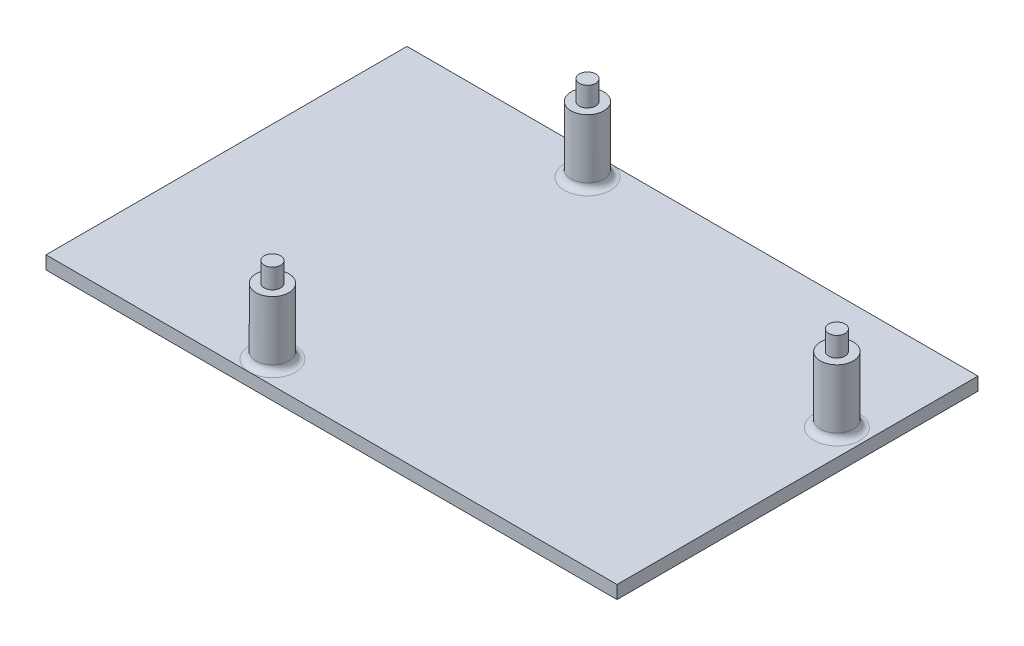
from build123d import *

# Parameters (mm, degrees)
SKETCH1_W           = 87
SKETCH1_H           = 55
BOSS_EXTRUDE1_DEPTH = 2
SKETCH2_R           = 2.5
BOSS_EXTRUDE2_DEPTH = 10
SKETCH3_R           = 1.25
BOSS_EXTRUDE3_DEPTH = 3
FILLET2_R           = 1


with BuildPart() as part:
    # Sketch1 → Boss-Extrude1 (new body)
    with BuildSketch(Plane(origin=(0, 0, 0), x_dir=(1, 0, 0), z_dir=(0, 1, 0))):
        with Locations((43.5, 27.5)):
            Rectangle(SKETCH1_W, SKETCH1_H)
    extrude(amount=BOSS_EXTRUDE1_DEPTH)

    # Sketch2 → Boss-Extrude2 (add)
    with BuildSketch(Plane(origin=(0, 2, 0), x_dir=(1, 0, 0), z_dir=(0, 1, 0))):
        with Locations(Location((31, 51.5, 0), (0, 0, 90))):
            Circle(SKETCH2_R)
        with Locations(Location((31, 3.5, 0), (0, 0, 90))):
            Circle(SKETCH2_R)
        with Locations(Location((83, 37.5, 0), (0, 0, 90))):
            Circle(SKETCH2_R)
    extrude(amount=BOSS_EXTRUDE2_DEPTH)

    # Sketch3 → Boss-Extrude3 (add)
    with BuildSketch(Plane(origin=(0, 12, 0), x_dir=(1, 0, 0), z_dir=(0, 1, 0))):
        with Locations(Location((31, 51.5, 0), (0, 0, 270))):
            Circle(SKETCH3_R)
        with Locations(Location((31, 3.5, 0), (0, 0, 270))):
            Circle(SKETCH3_R)
        with Locations(Location((83, 37.5, 0), (0, 0, 270))):
            Circle(SKETCH3_R)
    extrude(amount=BOSS_EXTRUDE3_DEPTH)

    # Fillet2
    fillet2_edges = [part.edges().sort_by_distance(p)[0] for p in [
        (83, 2, -35),
        (31, 2, -1),
        (31, 2, -49),
    ]]
    fillet(fillet2_edges, radius=FILLET2_R - 0.0001)  # a hair under: the kernel refuses the full size


solid = part.part
